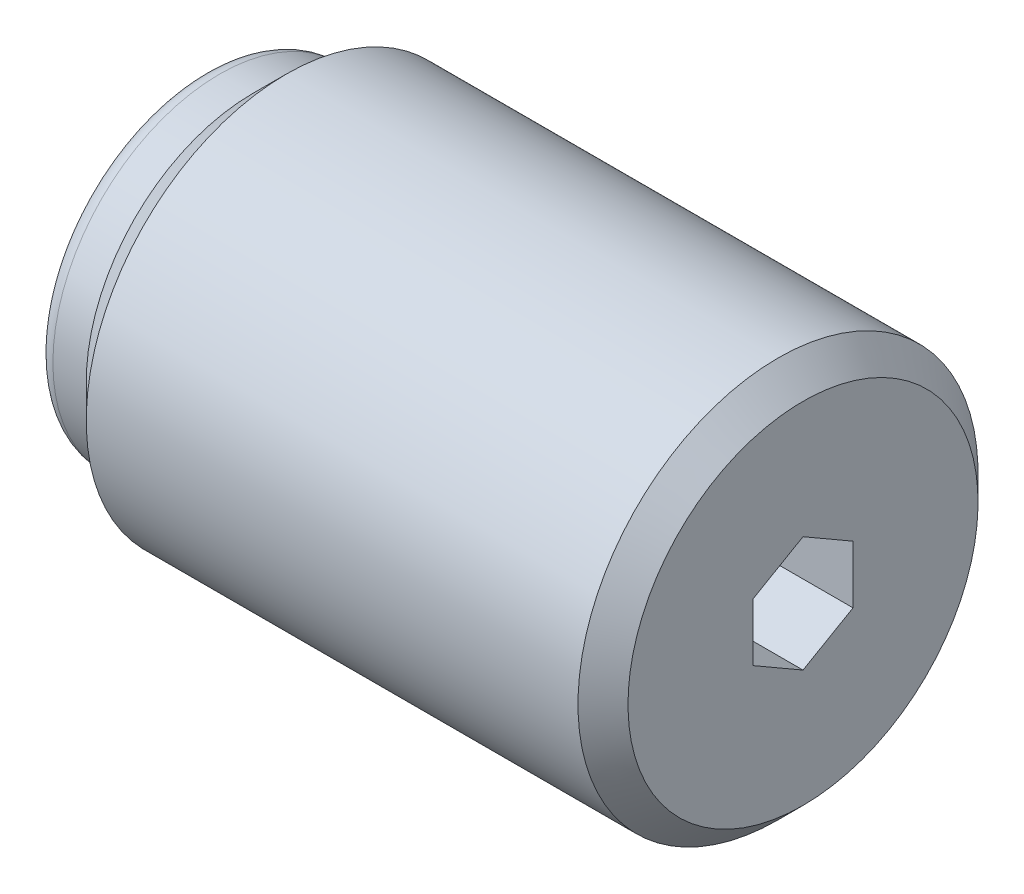
from build123d import *

# Parameters (mm, degrees)
CHAMFER1_SIZE  = 1.5
R1_RUNDING_R   = 1
SEKSKANT_DEPTH = 10


# Read off the part's stored shape, not the designer's step: Hul for sekskant
with BuildPart() as part:
    # Sketch1 → Base-Revolve (revolve)
    with BuildSketch(Plane.XY):
        Polygon((-36, 0), (-36, 10), (-33, 10), (-31, 12), (0, 12), (0, 0), align=None)
    revolve(axis=Axis((2, 0, 0), (-1, 0, 0)))

    # Chamfer1
    chamfer1_edges = [part.edges().sort_by_distance(p)[0] for p in [
        (0, -12, 0),
    ]]
    chamfer(chamfer1_edges, length=CHAMFER1_SIZE)

    # R1 runding
    r1_runding_edges = [part.edges().sort_by_distance(p)[0] for p in [
        (-36, -10, 0),
    ]]
    fillet(r1_runding_edges, radius=R1_RUNDING_R)

    # Hul for sekskant outline → Hul for sekskant (revolve, cut)
    with BuildSketch(Plane.YX):
        Polygon((0, 0), (0, -13.802581857), (3, -12), (3, 0), align=None)
    revolve(axis=Axis((0, 0, 0), (1, 0, 0)), mode=Mode.SUBTRACT)

    # Sketch8 → Sekskant (cut)
    with BuildSketch(Plane(origin=(0, 0, 0), x_dir=(0, 0, -1), z_dir=(1, 0, 0))):
        Polygon((-3, -1.732050808), (0, -3.464101615), (3, -1.732050808), (3, 1.732050808), (0, 3.464101615), (-3, 1.732050808), align=None)
    extrude(amount=-SEKSKANT_DEPTH, mode=Mode.SUBTRACT)


solid = part.part
